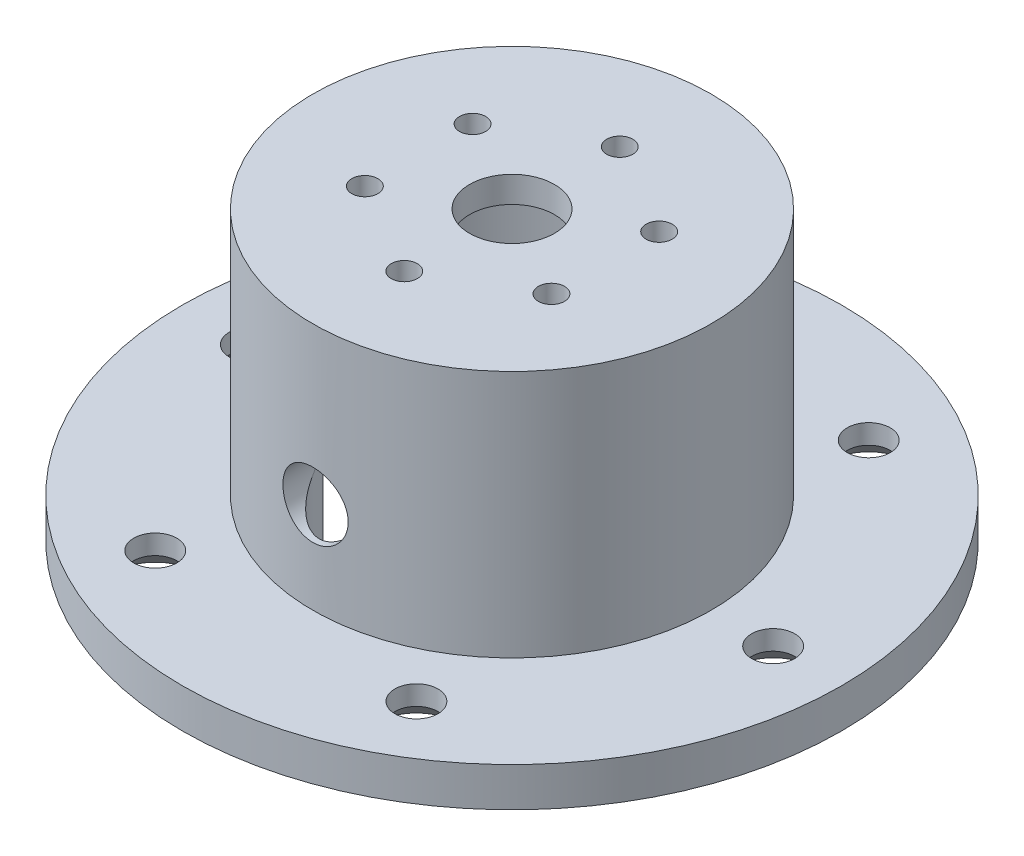
from build123d import *

# Parameters (mm, degrees)
SKETCH2_R                    = 1
SKETCH2_R_2                  = 1.65
CUT_EXTRUDE1_DEPTH           = 42.941924133
CHAMFER2_SIZE                = 1.5
CIRPATTERN1_COUNT            = 6
CHAMFER2_OF_CIRPATTERN1_SIZE = 1.5
SKETCH3_R                    = 2.5
CUT_EXTRUDE2_DEPTH           = 38.671275529
CUT_EXTRUDE3_START           = -10
CUT_EXTRUDE3_DEPTH           = 10


with BuildPart() as part:
    # Sketch1 → Revolve1 (revolve)
    with BuildSketch(Plane.XY):
        Polygon((3.25, 10), (3.25, 12), (15.25, 12), (15.25, -7), (25.25, -7), (25.25, -10), (12.25, -10), (12.25, 10), align=None)
    revolve(axis=Axis((0, -8.78125, 0), (0, 1, 0)))

    # Sketch2 → Cut-Extrude1 (cut, through all)
    with BuildSketch(Plane(origin=(0, 12, 0), x_dir=(1, 0, 0), z_dir=(0, 1, 0))):
        with Locations((0, 8.25)):
            Circle(SKETCH2_R)
        with Locations((20, 0)):
            Circle(SKETCH2_R_2)
    cut_extrude1 = extrude(amount=-CUT_EXTRUDE1_DEPTH, mode=Mode.SUBTRACT)

    # Chamfer2
    chamfer2_edges = [part.edges().sort_by_distance(p)[0] for p in [
        (18.35, -10, 0),
    ]]
    chamfer(chamfer2_edges, length=CHAMFER2_SIZE)

    # CirPattern1: Cut-Extrude1 ×6 about axis
    cirpattern1_axis = Axis((0, -8.78125, 0), (0, -1, 0))
    for i in range(1, CIRPATTERN1_COUNT):
        add(cut_extrude1.rotate(cirpattern1_axis, i * 360 / CIRPATTERN1_COUNT), mode=Mode.SUBTRACT)

    # Chamfer2 of CirPattern1
    chamfer2_of_cirpattern1_edges = [part.edges().sort_by_distance(p)[0] for p in [
        (9.175, -10, 15.891566159),
        (-9.175, -10, 15.891566159),
        (-18.35, -10, 0),
        (-9.175, -10, -15.891566159),
        (9.175, -10, -15.891566159),
    ]]
    chamfer(chamfer2_of_cirpattern1_edges, length=CHAMFER2_OF_CIRPATTERN1_SIZE)

    # Sketch3 → Cut-Extrude2 (cut, through all)
    with BuildSketch(Plane.XY):
        Circle(SKETCH3_R)
    extrude(amount=CUT_EXTRUDE2_DEPTH, mode=Mode.SUBTRACT)

    # Sketch4 → Cut-Extrude3 (cut)
    with BuildSketch(Plane.XZ.offset(10).offset(CUT_EXTRUDE3_START)):
        with BuildLine():
            ThreePointArc((2.5, 11.992184955), (0, 12.25), (-2.5, 11.992184955))
            ThreePointArc((-2.5, 11.992184955), (0, 14.763258562), (2.5, 11.992184955))
        make_face()
    extrude(amount=CUT_EXTRUDE3_DEPTH, mode=Mode.SUBTRACT)


solid = part.part
